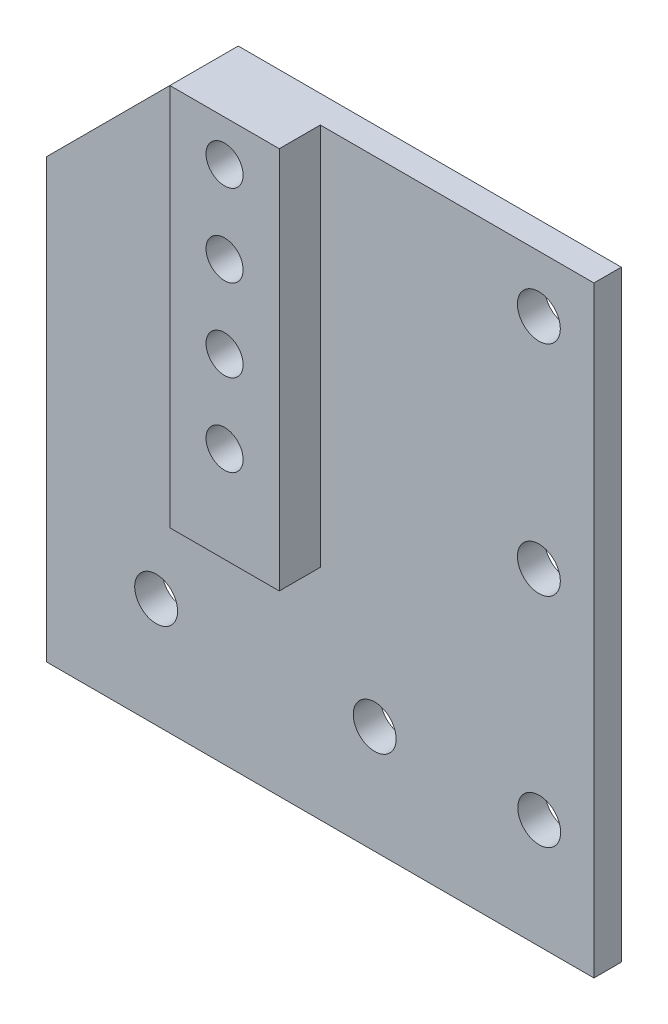
from build123d import *

# Parameters (mm, degrees)
BOSS_EXTRUDE1_DEPTH    = 3.175
F_10_CLEARANCE_HOLE1_D = 4.9784
SKETCH5_W              = 12.7
SKETCH5_H              = 44.45
BOSS_EXTRUDE2_DEPTH    = 4.7625
F_8_CLEARANCE_HOLE1_D  = 4.3053


with BuildPart() as part:
    # Sketch1 → Boss-Extrude1 (new body)
    with BuildSketch(Plane.XY):
        Polygon((-266.700000508, -12.7), (-266.700000508, 57.15), (-279.400000508, 57.15), (-311.150000508, 57.15), (-330.200000508, 38.1), (-330.200000508, 12.7), (-330.200000508, -12.7), (-279.400000508, -12.7), align=None)
    extrude(amount=BOSS_EXTRUDE1_DEPTH)

    # #10 Clearance Hole1 (through all)
    with Locations(Plane.XY.offset(3.175)):
        with Locations((-273.088229923, 50.598316496), (-273.088229923, 25.236545911), (-273.050000508, 0), (-317.500000508, 0), (-292.138229923, -0.163454089)):
            Hole(F_10_CLEARANCE_HOLE1_D / 2)

    # Sketch5 → Boss-Extrude2 (add)
    with BuildSketch(Plane.XY.offset(3.175)):
        with Locations((-304.800000508, 34.925)):
            Rectangle(SKETCH5_W, SKETCH5_H)
    extrude(amount=BOSS_EXTRUDE2_DEPTH)

    # #8 Clearance Hole1 (through all)
    with Locations(Plane.XY.offset(7.9375)):
        with Locations((-304.800000508, 42.8625), (-304.800000508, 52.3875), (-304.800000508, 33.3375), (-304.800000508, 23.8125)):
            Hole(F_8_CLEARANCE_HOLE1_D / 2)


solid = part.part
